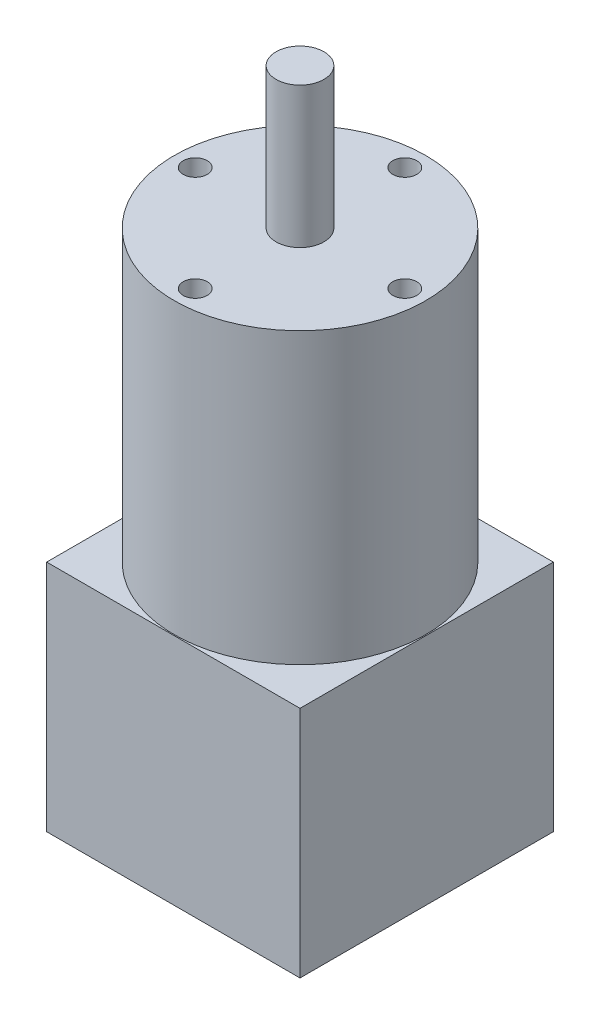
from build123d import *

# Parameters (mm, degrees)
SKETCH2_W           = 42.3
SKETCH2_H           = 42.3
BOSS_EXTRUDE1_DEPTH = 39
SKETCH3_R           = 21
BOSS_EXTRUDE2_DEPTH = 48.3
SKETCH4_R           = 4
BOSS_EXTRUDE3_DEPTH = 23.5
SKETCH5_R           = 2.5
BOSS_EXTRUDE4_DEPTH = 9.5
CUT_EXTRUDE1_START  = -2.6
SKETCH6_W           = 3
SKETCH6_H           = 3
CUT_EXTRUDE1_DEPTH  = 14
FILLET1_R           = 1.5
SKETCH7_R           = 2
CUT_EXTRUDE2_DEPTH  = 7


with BuildPart() as part:
    # Sketch2 → Boss-Extrude1 (new body)
    with BuildSketch(Plane(origin=(0, 0, 0), x_dir=(1, 0, 0), z_dir=(0, 1, 0))):
        Rectangle(SKETCH2_W, SKETCH2_H)
    extrude(amount=BOSS_EXTRUDE1_DEPTH)

    # Sketch3 → Boss-Extrude2 (add)
    with BuildSketch(Plane(origin=(0, 39, 0), x_dir=(1, 0, 0), z_dir=(0, 1, 0))):
        with Locations(Location((0, 0, 0), (0, 0, 90))):
            Circle(SKETCH3_R)
    extrude(amount=BOSS_EXTRUDE2_DEPTH)

    # Sketch4 → Boss-Extrude3 (add)
    with BuildSketch(Plane(origin=(0, 87.3, 0), x_dir=(1, 0, 0), z_dir=(0, 1, 0))):
        with Locations(Location((0, 0, 0), (0, 0, 270))):
            Circle(SKETCH4_R)
    extrude(amount=BOSS_EXTRUDE3_DEPTH)

    # Sketch5 → Boss-Extrude4 (add)
    with BuildSketch(Plane.XZ):
        with Locations(Location((0, 0, 0), (0, 0, 270))):
            Circle(SKETCH5_R)
    extrude(amount=BOSS_EXTRUDE4_DEPTH)

    # Sketch6 → Cut-Extrude1 (cut)
    with BuildSketch(Plane(origin=(0, 110.8, 0), x_dir=(1, 0, 0), z_dir=(0, 1, 0)).offset(CUT_EXTRUDE1_START)):
        with Locations((0, 3.7)):
            Rectangle(SKETCH6_W, SKETCH6_H)
    extrude(amount=-CUT_EXTRUDE1_DEPTH, mode=Mode.SUBTRACT)

    # Fillet1
    fillet1_edges = [part.edges().sort_by_distance(p)[0] for p in [
        (1.5, 94.2, -2.954049622),
        (-1.5, 94.2, -2.954049622),
        (1.5, 108.2, -2.954049622),
        (-1.5, 108.2, -2.954049622),
    ]]
    fillet(fillet1_edges, radius=FILLET1_R - 0.0001)  # a hair under: the kernel refuses the full size

    # Sketch7 → Cut-Extrude2 (cut)
    with BuildSketch(Plane(origin=(0, 87.3, 0), x_dir=(1, 0, 0), z_dir=(0, 1, 0))):
        with Locations(Location((0, 17.5, 0), (0, 0, 270))):
            Circle(SKETCH7_R)
        with Locations(Location((17.5, 0, 0), (0, 0, 270))):
            Circle(SKETCH7_R)
        with Locations(Location((0, -17.5, 0), (0, 0, 270))):
            Circle(SKETCH7_R)
        with Locations(Location((-17.5, 0, 0), (0, 0, 270))):
            Circle(SKETCH7_R)
    extrude(amount=-CUT_EXTRUDE2_DEPTH, mode=Mode.SUBTRACT)


solid = part.part
